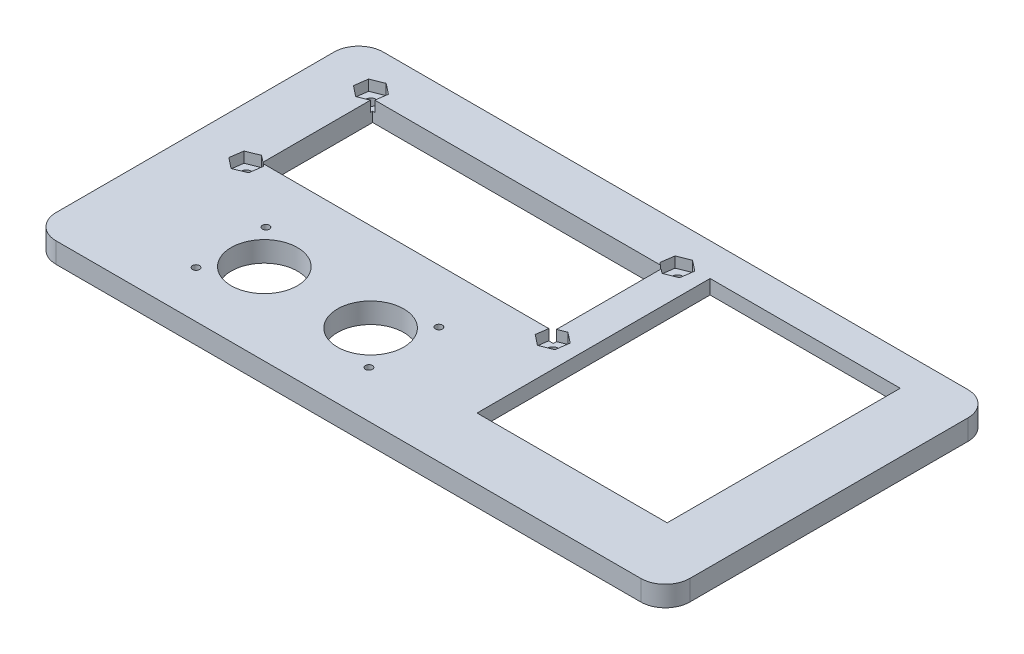
from build123d import *

# Parameters (mm, degrees)
SKETCH1_W                = 155
SKETCH1_H                = 80
BOSS_EXTRUDE1_DEPTH      = 5
SKETCH2_R                = 1.27
SKETCH2_W                = 71.2978
SKETCH2_H                = 27.1018
SCREEN_CUTOUT_DEPTH      = 88.357026048
SCREEN_HEX_NUTS_DEPTH    = 2.6
SKETCH3_R                = 8.1
SKETCH3_R_2              = 0.85
ULTRASOUND_CUTOUTS_DEPTH = 88.357026048
SKETCH5_W                = 12
SKETCH5_H                = 5
US_CLOCK_CUTOUT_DEPTH    = 4
SKETCH6_W                = 10
SKETCH6_H                = 3.5
US_PIN_CUTOUT_DEPTH      = 2
SKETCH9_R                = 3.15
MAGNET_HOLES_DEPTH       = 2.1
FILLET1_R                = 6
SKETCH10_W               = 46.5
SKETCH10_H               = 57
KEYPAD_CUTOUT_DEPTH      = 88.357026048
CUT_EXTRUDE1_DEPTH       = 1.5


with BuildPart() as part:
    # Sketch1 → Boss-Extrude1 (new body)
    with BuildSketch(Plane(origin=(0, 0, 0), x_dir=(1, 0, 0), z_dir=(0, 1, 0))):
        Rectangle(SKETCH1_W, SKETCH1_H)
    extrude(amount=BOSS_EXTRUDE1_DEPTH)

    # Sketch2 → Screen Cutout (cut, through all)
    with BuildSketch(Plane(origin=(0, 5, 0), x_dir=(1, 0, 0), z_dir=(0, 1, 0))):
        with Locations((-64.96, -0.02)):
            Circle(SKETCH2_R)
        with Locations((9.97, -0.02)):
            Circle(SKETCH2_R)
        with Locations((9.97, 30.46)):
            Circle(SKETCH2_R)
        with Locations((-64.96, 30.46)):
            Circle(SKETCH2_R)
        with Locations((-27.2029, 15.22)):
            Rectangle(SKETCH2_W, SKETCH2_H)
    extrude(amount=-SCREEN_CUTOUT_DEPTH, mode=Mode.SUBTRACT)

    # Sketch8 → Screen hex nuts (cut)
    with BuildSketch(Plane(origin=(0, 5, 0), x_dir=(1, 0, 0), z_dir=(0, 1, 0))):
        Polygon((-68.013462423, 29.232658469), (-65.423822267, 27.201953207), (-62.370359844, 28.429294738), (-61.906537577, 31.687341531), (-64.496177733, 33.718046793), (-67.549640156, 32.490705262), align=None)
        Polygon((6.916537856, 29.232657776), (9.506178473, 27.201953102), (12.559640617, 28.429295326), (13.023462144, 31.687342224), (10.433821527, 33.718046898), (7.380359383, 32.490704674), align=None)
        Polygon((6.916537628, -1.247341658), (9.506177869, -3.278046812), (12.559640241, -2.050705154), (13.023462372, 1.207341658), (10.433822131, 3.238046812), (7.380359759, 2.010705154), align=None)
        Polygon((-68.013462387, -1.247341619), (-65.423822172, -3.278046806), (-62.370359785, -2.050705187), (-61.906537613, 1.207341619), (-64.496177828, 3.238046806), (-67.549640215, 2.010705187), align=None)
    extrude(amount=-SCREEN_HEX_NUTS_DEPTH, mode=Mode.SUBTRACT)

    # Sketch3 → Ultrasound Cutouts (cut, through all)
    with BuildSketch(Plane(origin=(0, 5, 0), x_dir=(1, 0, 0), z_dir=(0, 1, 0))):
        with Locations((-40.58183153, -20)):
            Circle(SKETCH3_R)
        with Locations((-14.58183153, -20)):
            Circle(SKETCH3_R)
        with Locations((-48.73183153, -11.45)):
            Circle(SKETCH3_R_2)
        with Locations((-6.43183153, -11.45)):
            Circle(SKETCH3_R_2)
        with Locations((-6.43183153, -28.55)):
            Circle(SKETCH3_R_2)
        with Locations((-48.73183153, -28.55)):
            Circle(SKETCH3_R_2)
    extrude(amount=-ULTRASOUND_CUTOUTS_DEPTH, mode=Mode.SUBTRACT)

    # Sketch5 → US Clock cutout (cut)
    with BuildSketch(Plane.XZ):
        with Locations((-27.471992442, 27.55)):
            Rectangle(SKETCH5_W, SKETCH5_H)
    extrude(amount=-US_CLOCK_CUTOUT_DEPTH, mode=Mode.SUBTRACT)

    # Sketch6 → US Pin cutout (cut)
    with BuildSketch(Plane.XZ):
        with Locations((-27.471992442, 11.55)):
            Rectangle(SKETCH6_W, SKETCH6_H)
    extrude(amount=-US_PIN_CUTOUT_DEPTH, mode=Mode.SUBTRACT)

    # Sketch9 → Magnet Holes (cut)
    with BuildSketch(Plane(origin=(0, 0.2, 0), x_dir=(-1, 0, 0), z_dir=(0, -1, 0))):
        with Locations((-71.5, 34)):
            Circle(SKETCH9_R)
        with Locations((71.5, 34)):
            Circle(SKETCH9_R)
        with Locations((-71.5, -34)):
            Circle(SKETCH9_R)
        with Locations((71.5, -34)):
            Circle(SKETCH9_R)
    extrude(amount=-MAGNET_HOLES_DEPTH, mode=Mode.SUBTRACT)

    # Fillet1
    fillet1_edges = [part.edges().sort_by_distance(p)[0] for p in [
        (77.5, 2.5, -40),
        (77.5, 2.5, 40),
        (-77.5, 2.5, 40),
        (-77.5, 2.5, -40),
    ]]
    fillet(fillet1_edges, radius=FILLET1_R)

    # Sketch10 → Keypad cutout (cut, through all)
    with BuildSketch(Plane(origin=(0, 5, 0), x_dir=(1, 0, 0), z_dir=(0, 1, 0))):
        with Locations((39.696, 3.5)):
            Rectangle(SKETCH10_W, SKETCH10_H)
    extrude(amount=-KEYPAD_CUTOUT_DEPTH, mode=Mode.SUBTRACT)

    # Sketch11 → Cut-Extrude1 (cut)
    with BuildSketch(Plane.XZ):
        Polygon((58.696, 28.5), (58.696, 34.5), (20.696, 34.5), (20.696, 28.5), (13.696, 28.5), (13.696, -35.5), (65.696, -35.5), (65.696, 28.5), align=None)
    extrude(amount=-CUT_EXTRUDE1_DEPTH, mode=Mode.SUBTRACT)


solid = part.part
